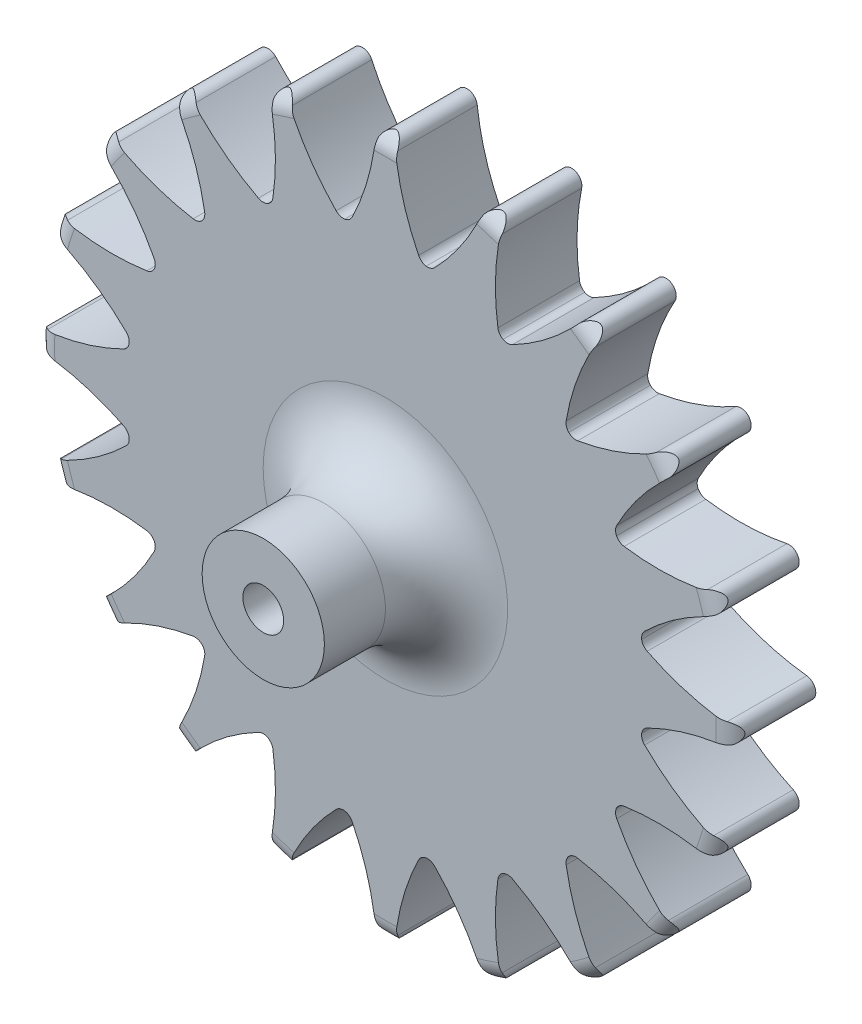
from build123d import *

# Parameters (mm, degrees)
BOSS_EXTRUDE1_DEPTH = 10
BOSS_EXTRUDE3_DEPTH = 10
FILLET2_R           = 0.5
CIRPATTERN2_DEPTH   = 10
SKETCH6_R           = 12.732395447
SKETCH6_R_2         = 3
CUT_EXTRUDE1_DEPTH  = 25.935184132
FILLET3_R           = 3


# Read off the part's stored shape, not the designer's step: CirPattern2
with BuildPart() as part:
    # Sketch2 → Boss-Extrude1 (new body)
    with BuildSketch(Plane.XY):
        with BuildLine():
            Line((-1.75, 12.611557946), (1.75, 12.611557946))
            ThreePointArc((1.75, 12.611557946), (0.938039397, 14.582853861), (0.5, 16.669336329))
            ThreePointArc((0.5, 16.669336329), (0, 17.114885217), (-0.5, 16.669336329))
            ThreePointArc((-0.5, 16.669336329), (-0.938039397, 14.582853861), (-1.75, 12.611557946))
        make_face()
    extrude(amount=BOSS_EXTRUDE1_DEPTH)

    # Sketch2<4> → Boss-Extrude3 (add)
    with BuildSketch(Plane.XY):
        with BuildLine():
            Line((-0.741718424, 5.34527136), (-1.75, 12.611557946))
            ThreePointArc((-1.75, 12.611557946), (-8.361584832, -9.60196818), (12.732395447, 0))
            ThreePointArc((12.732395447, 0), (9.60196818, 8.361584832), (1.75, 12.611557946))
            Line((1.75, 12.611557946), (0.741718424, 5.34527136))
            Line((0.741718424, 5.34527136), (4.566987298, 3.136751346))
            ThreePointArc((4.566987298, 3.136751346), (5.129409523, 3.369714259), (5.5, 2.886751346))
            ThreePointArc((5.5, 2.886751346), (5.353553391, 2.533197955), (5, 2.386751346))
            Line((5, 2.386751346), (5, -2.386751346))
            ThreePointArc((5, -2.386751346), (5.353553391, -2.533197955), (5.5, -2.886751346))
            ThreePointArc((5.5, -2.886751346), (5.129409523, -3.369714259), (4.566987298, -3.136751346))
            Line((4.566987298, -3.136751346), (0.433012702, -5.523502692))
            ThreePointArc((0.433012702, -5.523502692), (0.482962913, -5.644093169), (0.5, -5.773502692))
            ThreePointArc((0.5, -5.773502692), (-0.129409523, -6.256465605), (-0.433012702, -5.523502692))
            Line((-0.433012702, -5.523502692), (-4.566987298, -3.136751346))
            ThreePointArc((-4.566987298, -3.136751346), (-5.433012702, -3.136751346), (-5, -2.386751346))
            Line((-5, -2.386751346), (-5, 2.386751346))
            ThreePointArc((-5, 2.386751346), (-5.433012702, 3.136751346), (-4.566987298, 3.136751346))
            Line((-4.566987298, 3.136751346), (-0.741718424, 5.34527136))
        make_face()
        with BuildLine():
            Line((-0.5, 12.611557946), (-1.75, 12.611557946))
            Line((-1.75, 12.611557946), (-0.741718424, 5.34527136))
            Line((-0.741718424, 5.34527136), (-0.433012702, 5.523502692))
            ThreePointArc((-0.433012702, 5.523502692), (-0.129409523, 6.256465605), (0.5, 5.773502692))
            ThreePointArc((0.5, 5.773502692), (0.482962913, 5.644093169), (0.433012702, 5.523502692))
            Line((0.433012702, 5.523502692), (0.741718424, 5.34527136))
            Line((0.741718424, 5.34527136), (1.75, 12.611557946))
            Line((1.75, 12.611557946), (-0.5, 12.611557946))
        make_face()
        with BuildLine():
            ThreePointArc((0.5, 5.773502692), (-0.129409523, 6.256465605), (-0.433012702, 5.523502692))
            Line((-0.433012702, 5.523502692), (0, 5.773502692))
            Line((0, 5.773502692), (0.433012702, 5.523502692))
            ThreePointArc((0.433012702, 5.523502692), (0.482962913, 5.644093169), (0.5, 5.773502692))
        make_face()
        with BuildLine():
            Line((0, 5.773502692), (-0.433012702, 5.523502692))
            ThreePointArc((-0.433012702, 5.523502692), (0, 5.273502692), (0.433012702, 5.523502692))
            Line((0.433012702, 5.523502692), (0, 5.773502692))
        make_face()
        with BuildLine():
            ThreePointArc((5.5, 2.886751346), (5.129409523, 3.369714259), (4.566987298, 3.136751346))
            Line((4.566987298, 3.136751346), (5, 2.886751346))
            Line((5, 2.886751346), (5, 2.386751346))
            ThreePointArc((5, 2.386751346), (5.353553391, 2.533197955), (5.5, 2.886751346))
        make_face()
        with BuildLine():
            Line((5, 2.886751346), (4.566987298, 3.136751346))
            ThreePointArc((4.566987298, 3.136751346), (4.566987298, 2.636751346), (5, 2.386751346))
            Line((5, 2.386751346), (5, 2.886751346))
        make_face()
        with BuildLine():
            ThreePointArc((5.5, -2.886751346), (5.353553391, -2.533197955), (5, -2.386751346))
            Line((5, -2.386751346), (5, -2.886751346))
            Line((5, -2.886751346), (4.566987298, -3.136751346))
            ThreePointArc((4.566987298, -3.136751346), (5.129409523, -3.369714259), (5.5, -2.886751346))
        make_face()
        with BuildLine():
            Line((5, -2.886751346), (5, -2.386751346))
            ThreePointArc((5, -2.386751346), (4.566987298, -2.636751346), (4.566987298, -3.136751346))
            Line((4.566987298, -3.136751346), (5, -2.886751346))
        make_face()
        with BuildLine():
            ThreePointArc((0.433012702, -5.523502692), (0, -5.273502692), (-0.433012702, -5.523502692))
            Line((-0.433012702, -5.523502692), (0, -5.773502692))
            Line((0, -5.773502692), (0.433012702, -5.523502692))
        make_face()
        with BuildLine():
            Line((0, -5.773502692), (-0.433012702, -5.523502692))
            ThreePointArc((-0.433012702, -5.523502692), (-0.129409523, -6.256465605), (0.5, -5.773502692))
            ThreePointArc((0.5, -5.773502692), (0.482962913, -5.644093169), (0.433012702, -5.523502692))
            Line((0.433012702, -5.523502692), (0, -5.773502692))
        make_face()
        with BuildLine():
            ThreePointArc((-4.5, -2.886751346), (-4.646446609, -2.533197955), (-5, -2.386751346))
            Line((-5, -2.386751346), (-5, -2.886751346))
            Line((-5, -2.886751346), (-4.566987298, -3.136751346))
            ThreePointArc((-4.566987298, -3.136751346), (-4.517037087, -3.016160868), (-4.5, -2.886751346))
        make_face()
        with BuildLine():
            Line((-5, -2.886751346), (-5, -2.386751346))
            ThreePointArc((-5, -2.386751346), (-5.433012702, -3.136751346), (-4.566987298, -3.136751346))
            Line((-4.566987298, -3.136751346), (-5, -2.886751346))
        make_face()
        with BuildLine():
            ThreePointArc((-4.5, 2.886751346), (-4.517037087, 3.016160868), (-4.566987298, 3.136751346))
            Line((-4.566987298, 3.136751346), (-5, 2.886751346))
            Line((-5, 2.886751346), (-5, 2.386751346))
            ThreePointArc((-5, 2.386751346), (-4.646446609, 2.533197955), (-4.5, 2.886751346))
        make_face()
        with BuildLine():
            Line((-5, 2.886751346), (-4.566987298, 3.136751346))
            ThreePointArc((-4.566987298, 3.136751346), (-5.433012702, 3.136751346), (-5, 2.386751346))
            Line((-5, 2.386751346), (-5, 2.886751346))
        make_face()
        with BuildLine():
            Line((-0.137444679, 0.990509445), (-0.741718424, 5.34527136))
            Line((-0.741718424, 5.34527136), (-4.566987298, 3.136751346))
            ThreePointArc((-4.566987298, 3.136751346), (-4.517037087, 3.016160868), (-4.5, 2.886751346))
            ThreePointArc((-4.5, 2.886751346), (-4.646446609, 2.533197955), (-5, 2.386751346))
            Line((-5, 2.386751346), (-5, -2.386751346))
            ThreePointArc((-5, -2.386751346), (-4.646446609, -2.533197955), (-4.5, -2.886751346))
            ThreePointArc((-4.5, -2.886751346), (-4.517037087, -3.016160868), (-4.566987298, -3.136751346))
            Line((-4.566987298, -3.136751346), (-0.433012702, -5.523502692))
            ThreePointArc((-0.433012702, -5.523502692), (0, -5.273502692), (0.433012702, -5.523502692))
            Line((0.433012702, -5.523502692), (4.566987298, -3.136751346))
            ThreePointArc((4.566987298, -3.136751346), (4.566987298, -2.636751346), (5, -2.386751346))
            Line((5, -2.386751346), (5, 2.386751346))
            ThreePointArc((5, 2.386751346), (4.566987298, 2.636751346), (4.566987298, 3.136751346))
            Line((4.566987298, 3.136751346), (0.741718424, 5.34527136))
            Line((0.741718424, 5.34527136), (0.137444679, 0.990509445))
            ThreePointArc((0.137444679, 0.990509445), (0.754136817, 0.656717337), (1, 0))
            ThreePointArc((1, 0), (-0.656717337, -0.754136817), (-0.137444679, 0.990509445))
        make_face()
        with BuildLine():
            Line((-0.433012702, 5.523502692), (-0.741718424, 5.34527136))
            Line((-0.741718424, 5.34527136), (-0.137444679, 0.990509445))
            ThreePointArc((-0.137444679, 0.990509445), (0, 1), (0.137444679, 0.990509445))
            Line((0.137444679, 0.990509445), (0.741718424, 5.34527136))
            Line((0.741718424, 5.34527136), (0.433012702, 5.523502692))
            ThreePointArc((0.433012702, 5.523502692), (0, 5.273502692), (-0.433012702, 5.523502692))
        make_face()
    extrude(amount=BOSS_EXTRUDE3_DEPTH)

    # Fillet2
    fillet2_edges = [part.edges().sort_by_distance(p)[0] for p in [
        (1.75, 12.611557946, 5),
        (-1.75, 12.611557946, 5),
    ]]
    fillet(fillet2_edges, radius=FILLET2_R)

    # CirPattern2 outline → CirPattern2 (add)
    with BuildSketch(Plane.XY):
        with BuildLine():
            ThreePointArc((-4.675579953, 16.007989436), (-5.288790389, 16.277223111), (-5.626636469, 15.698972441))
            ThreePointArc((-5.626636469, 15.698972441), (-5.401243132, 13.710891157), (-5.52033084, 11.713621154))
            ThreePointArc((-5.52033084, 11.713621154), (-5.608770074, 11.494781631), (-5.787743342, 11.340895945))
            ThreePointArc((-5.787743342, 11.340895945), (-3.942379627, 12.10667323), (-1.999941442, 12.574344041))
            ThreePointArc((-1.999941442, 12.574344041), (-2.226531714, 12.59866661), (-2.418792046, 12.721021438))
            ThreePointArc((-2.418792046, 12.721021438), (-3.689256776, 14.266961557), (-4.675579953, 16.007989436))
        make_face()
        with BuildLine():
            ThreePointArc((1.999941442, 12.574344041), (3.934526572, 12.109227658), (5.77302737, 11.348394107))
            ThreePointArc((5.77302737, 11.348394107), (5.604008437, 11.5012579), (5.520384924, 11.713252822))
            ThreePointArc((5.520384924, 11.713252822), (5.40123817, 13.710705083), (5.626636469, 15.698972441))
            ThreePointArc((5.626636469, 15.698972441), (5.288790389, 16.277223111), (4.675579953, 16.007989436))
            ThreePointArc((4.675579953, 16.007989436), (3.689256776, 14.266961557), (2.418792046, 12.721021438))
            ThreePointArc((2.418792046, 12.721021438), (2.226531714, 12.59866661), (1.999941442, 12.574344041))
        make_face()
        with BuildLine():
            ThreePointArc((5.77302737, 11.348394107), (7.477231785, 10.305576096), (8.997321938, 9.009000599))
            ThreePointArc((8.997321938, 9.009000599), (8.883812889, 9.206612427), (8.869792236, 9.434072666))
            ThreePointArc((8.869792236, 9.434072666), (9.373723633, 11.370581026), (10.202498557, 13.191883749))
            ThreePointArc((10.202498557, 13.191883749), (10.059877125, 13.846232997), (9.393481563, 13.779669002))
            ThreePointArc((9.393481563, 13.779669002), (7.917572898, 12.428757103), (6.231749524, 11.35113523))
            ThreePointArc((6.231749524, 11.35113523), (6.002721353, 11.294053428), (5.77302737, 11.348394107))
        make_face()
        with BuildLine():
            ThreePointArc((8.997321938, 9.009000599), (10.295868163, 7.490593607), (11.340895945, 5.787743342))
            ThreePointArc((11.340895945, 5.787743342), (11.294007838, 6.010759585), (11.350962485, 6.231419747))
            ThreePointArc((11.350962485, 6.231419747), (12.428643716, 7.917425277), (13.779669002, 9.393481563))
            ThreePointArc((13.779669002, 9.393481563), (13.846232997, 10.059877125), (13.191883749, 10.202498557))
            ThreePointArc((13.191883749, 10.202498557), (11.370756461, 9.373785852), (9.434439684, 8.86985462))
            ThreePointArc((9.434439684, 8.86985462), (9.198981703, 8.886340198), (8.997321938, 9.009000599))
        make_face()
        with BuildLine():
            ThreePointArc((11.340895945, 5.787743342), (12.10667323, 3.942379627), (12.574344041, 1.999941442))
            ThreePointArc((12.574344041, 1.999941442), (12.59866661, 2.226531714), (12.721021438, 2.418792046))
            ThreePointArc((12.721021438, 2.418792046), (14.266961557, 3.689256776), (16.007989436, 4.675579953))
            ThreePointArc((16.007989436, 4.675579953), (16.277223111, 5.288790389), (15.698972441, 5.626636469))
            ThreePointArc((15.698972441, 5.626636469), (13.710891157, 5.401243132), (11.713621154, 5.52033084))
            ThreePointArc((11.713621154, 5.52033084), (11.494781631, 5.608770074), (11.340895945, 5.787743342))
        make_face()
        with BuildLine():
            ThreePointArc((12.574344041, 1.999941442), (12.732392769, 0.00825806), (12.576927731, -1.983628662))
            ThreePointArc((12.576927731, -1.983628662), (12.670080115, -1.775644594), (12.845858181, -1.630603873))
            ThreePointArc((12.845858181, -1.630603873), (14.708729797, -0.900041882), (16.669336329, -0.5))
            ThreePointArc((16.669336329, -0.5), (17.114885217, 0), (16.669336329, 0.5))
            ThreePointArc((16.669336329, 0.5), (14.708908298, 0.899989101), (12.846191773, 1.630438616))
            ThreePointArc((12.846191773, 1.630438616), (12.665392244, 1.782174457), (12.574344041, 1.999941442))
        make_face()
        with BuildLine():
            ThreePointArc((12.576927731, -1.983628662), (12.111776992, -3.926671863), (11.348394107, -5.77302737))
            ThreePointArc((11.348394107, -5.77302737), (11.5012579, -5.604008437), (11.713252822, -5.520384924))
            ThreePointArc((11.713252822, -5.520384924), (13.710705083, -5.40123817), (15.698972441, -5.626636469))
            ThreePointArc((15.698972441, -5.626636469), (16.277223111, -5.288790389), (16.007989436, -4.675579953))
            ThreePointArc((16.007989436, -4.675579953), (14.267115011, -3.689362134), (12.721287635, -2.419052301))
            ThreePointArc((12.721287635, -2.419052301), (12.596226019, -2.218872814), (12.576927731, -1.983628662))
        make_face()
        with BuildLine():
            ThreePointArc((11.348394107, -5.77302737), (10.305576096, -7.477231785), (9.009000598, -8.997321937))
            ThreePointArc((9.009000598, -8.997321937), (9.206612427, -8.883812889), (9.434072666, -8.869792236))
            ThreePointArc((9.434072666, -8.869792236), (11.370581026, -9.373723633), (13.191883749, -10.202498557))
            ThreePointArc((13.191883749, -10.202498557), (13.846232997, -10.059877125), (13.779669002, -9.393481563))
            ThreePointArc((13.779669002, -9.393481563), (12.428757103, -7.917572898), (11.35113523, -6.231749524))
            ThreePointArc((11.35113523, -6.231749524), (11.294053428, -6.002721353), (11.348394107, -5.77302737))
        make_face()
        with BuildLine():
            ThreePointArc((9.009000598, -8.997321937), (7.490593607, -10.295868163), (5.787743342, -11.340895945))
            ThreePointArc((5.787743342, -11.340895945), (6.010759585, -11.294007838), (6.231419747, -11.350962485))
            ThreePointArc((6.231419747, -11.350962485), (7.917425277, -12.428643716), (9.393481563, -13.779669002))
            ThreePointArc((9.393481563, -13.779669002), (10.059877125, -13.846232997), (10.202498557, -13.191883749))
            ThreePointArc((10.202498557, -13.191883749), (9.373785852, -11.370756461), (8.86985462, -9.434439684))
            ThreePointArc((8.86985462, -9.434439684), (8.886340198, -9.198981703), (9.009000598, -8.997321937))
        make_face()
        with BuildLine():
            ThreePointArc((5.787743342, -11.340895945), (3.942379627, -12.10667323), (1.999941442, -12.57434404))
            ThreePointArc((1.999941442, -12.57434404), (2.226531714, -12.59866661), (2.418792046, -12.721021438))
            ThreePointArc((2.418792046, -12.721021438), (3.689256776, -14.266961557), (4.675579953, -16.007989436))
            ThreePointArc((4.675579953, -16.007989436), (5.288790389, -16.277223111), (5.626636469, -15.698972441))
            ThreePointArc((5.626636469, -15.698972441), (5.401243132, -13.710891157), (5.52033084, -11.713621154))
            ThreePointArc((5.52033084, -11.713621154), (5.608770074, -11.494781631), (5.787743342, -11.340895945))
        make_face()
        with BuildLine():
            ThreePointArc((1.999941442, -12.57434404), (0.00825806, -12.732392769), (-1.983628662, -12.576927731))
            ThreePointArc((-1.983628662, -12.576927731), (-1.775644594, -12.670080115), (-1.630603873, -12.845858181))
            ThreePointArc((-1.630603873, -12.845858181), (-0.900041882, -14.708729797), (-0.5, -16.669336329))
            ThreePointArc((-0.5, -16.669336329), (0, -17.114885217), (0.5, -16.669336329))
            ThreePointArc((0.5, -16.669336329), (0.899989101, -14.708908298), (1.630438616, -12.846191773))
            ThreePointArc((1.630438616, -12.846191773), (1.782174457, -12.665392244), (1.999941442, -12.57434404))
        make_face()
        with BuildLine():
            ThreePointArc((-1.983628662, -12.576927731), (-3.926671863, -12.111776992), (-5.77302737, -11.348394107))
            ThreePointArc((-5.77302737, -11.348394107), (-5.604008437, -11.5012579), (-5.520384924, -11.713252822))
            ThreePointArc((-5.520384924, -11.713252822), (-5.40123817, -13.710705083), (-5.626636469, -15.698972441))
            ThreePointArc((-5.626636469, -15.698972441), (-5.288790389, -16.277223111), (-4.675579953, -16.007989436))
            ThreePointArc((-4.675579953, -16.007989436), (-3.689362134, -14.267115011), (-2.419052301, -12.721287635))
            ThreePointArc((-2.419052301, -12.721287635), (-2.218872814, -12.596226019), (-1.983628662, -12.576927731))
        make_face()
        with BuildLine():
            ThreePointArc((-5.77302737, -11.348394107), (-7.477231785, -10.305576095), (-8.997321937, -9.009000598))
            ThreePointArc((-8.997321937, -9.009000598), (-8.883812889, -9.206612427), (-8.869792236, -9.434072666))
            ThreePointArc((-8.869792236, -9.434072666), (-9.373723633, -11.370581026), (-10.202498557, -13.191883749))
            ThreePointArc((-10.202498557, -13.191883749), (-10.059877125, -13.846232997), (-9.393481563, -13.779669002))
            ThreePointArc((-9.393481563, -13.779669002), (-7.917572898, -12.428757103), (-6.231749524, -11.35113523))
            ThreePointArc((-6.231749524, -11.35113523), (-6.002721353, -11.294053428), (-5.77302737, -11.348394107))
        make_face()
        with BuildLine():
            ThreePointArc((-8.997321937, -9.009000598), (-10.295868163, -7.490593607), (-11.340895945, -5.787743342))
            ThreePointArc((-11.340895945, -5.787743342), (-11.294007838, -6.010759585), (-11.350962485, -6.231419747))
            ThreePointArc((-11.350962485, -6.231419747), (-12.428643716, -7.917425277), (-13.779669002, -9.393481563))
            ThreePointArc((-13.779669002, -9.393481563), (-13.846232997, -10.059877125), (-13.191883749, -10.202498557))
            ThreePointArc((-13.191883749, -10.202498557), (-11.370756461, -9.373785852), (-9.434439684, -8.86985462))
            ThreePointArc((-9.434439684, -8.86985462), (-9.198981703, -8.886340198), (-8.997321937, -9.009000598))
        make_face()
        with BuildLine():
            ThreePointArc((-11.340895945, -5.787743342), (-12.10667323, -3.942379627), (-12.574344041, -1.999941442))
            ThreePointArc((-12.574344041, -1.999941442), (-12.59866661, -2.226531714), (-12.721021438, -2.418792046))
            ThreePointArc((-12.721021438, -2.418792046), (-14.266961557, -3.689256776), (-16.007989436, -4.675579953))
            ThreePointArc((-16.007989436, -4.675579953), (-16.277223111, -5.288790389), (-15.698972441, -5.626636469))
            ThreePointArc((-15.698972441, -5.626636469), (-13.710891157, -5.401243132), (-11.713621154, -5.52033084))
            ThreePointArc((-11.713621154, -5.52033084), (-11.494781631, -5.608770074), (-11.340895945, -5.787743342))
        make_face()
        with BuildLine():
            ThreePointArc((-12.574344041, -1.999941442), (-12.732392769, -0.00825806), (-12.576927731, 1.983628662))
            ThreePointArc((-12.576927731, 1.983628662), (-12.670080115, 1.775644594), (-12.845858181, 1.630603873))
            ThreePointArc((-12.845858181, 1.630603873), (-14.708729797, 0.900041882), (-16.669336329, 0.5))
            ThreePointArc((-16.669336329, 0.5), (-17.114885217, 0), (-16.669336329, -0.5))
            ThreePointArc((-16.669336329, -0.5), (-14.708908298, -0.899989101), (-12.846191773, -1.630438616))
            ThreePointArc((-12.846191773, -1.630438616), (-12.665392244, -1.782174457), (-12.574344041, -1.999941442))
        make_face()
        with BuildLine():
            ThreePointArc((-12.576927731, 1.983628662), (-12.111776992, 3.926671863), (-11.348394107, 5.77302737))
            ThreePointArc((-11.348394107, 5.77302737), (-11.5012579, 5.604008437), (-11.713252822, 5.520384924))
            ThreePointArc((-11.713252822, 5.520384924), (-13.710705083, 5.40123817), (-15.698972441, 5.626636469))
            ThreePointArc((-15.698972441, 5.626636469), (-16.277223111, 5.288790389), (-16.007989436, 4.675579953))
            ThreePointArc((-16.007989436, 4.675579953), (-14.267115011, 3.689362134), (-12.721287635, 2.419052301))
            ThreePointArc((-12.721287635, 2.419052301), (-12.596226019, 2.218872814), (-12.576927731, 1.983628662))
        make_face()
        with BuildLine():
            ThreePointArc((-11.348394107, 5.77302737), (-10.305576096, 7.477231785), (-9.009000599, 8.997321938))
            ThreePointArc((-9.009000599, 8.997321938), (-9.206612427, 8.883812889), (-9.434072666, 8.869792236))
            ThreePointArc((-9.434072666, 8.869792236), (-11.370581026, 9.373723633), (-13.191883749, 10.202498557))
            ThreePointArc((-13.191883749, 10.202498557), (-13.846232997, 10.059877125), (-13.779669002, 9.393481563))
            ThreePointArc((-13.779669002, 9.393481563), (-12.428757103, 7.917572898), (-11.35113523, 6.231749524))
            ThreePointArc((-11.35113523, 6.231749524), (-11.294053428, 6.002721353), (-11.348394107, 5.77302737))
        make_face()
        with BuildLine():
            ThreePointArc((-9.009000599, 8.997321938), (-7.490593608, 10.295868163), (-5.787743342, 11.340895945))
            ThreePointArc((-5.787743342, 11.340895945), (-6.010759585, 11.294007838), (-6.231419747, 11.350962485))
            ThreePointArc((-6.231419747, 11.350962485), (-7.917425277, 12.428643716), (-9.393481563, 13.779669002))
            ThreePointArc((-9.393481563, 13.779669002), (-10.059877125, 13.846232997), (-10.202498557, 13.191883749))
            ThreePointArc((-10.202498557, 13.191883749), (-9.373785852, 11.370756461), (-8.86985462, 9.434439684))
            ThreePointArc((-8.86985462, 9.434439684), (-8.886340198, 9.198981703), (-9.009000599, 8.997321938))
        make_face()
    extrude(amount=CIRPATTERN2_DEPTH)

    # Sketch4 → Cut-Revolve2 (revolve, cut)
    with BuildSketch(Plane(origin=(0, 0, 0), x_dir=(1, 0, 0), z_dir=(0, 1, 0))):
        with BuildLine():
            Line((12.732395447, -4.006269207), (6, -10))
            Line((6, -10), (17.232395447, -10))
            Line((17.232395447, -10), (17.232395447, -3.006269207))
            ThreePointArc((17.232395447, -3.006269207), (16.939502229, -3.713375988), (16.232395447, -4.006269207))
            Line((16.232395447, -4.006269207), (12.732395447, -4.006269207))
        make_face()
    revolve(axis=Axis((0, 0, 0), (0, 0, 1)), mode=Mode.SUBTRACT)

    # Sketch6 → Cut-Extrude1 (cut, through all)
    with BuildSketch(Plane.XY.offset(4.006269207)):
        Circle(SKETCH6_R)
        Circle(SKETCH6_R_2, mode=Mode.SUBTRACT)
    extrude(amount=CUT_EXTRUDE1_DEPTH, mode=Mode.SUBTRACT)

    # Fillet3
    fillet3_edges = [part.edges().sort_by_distance(p)[0] for p in [
        (-3, 0, 4.006269207),
    ]]
    fillet(fillet3_edges, radius=FILLET3_R)


solid = part.part
